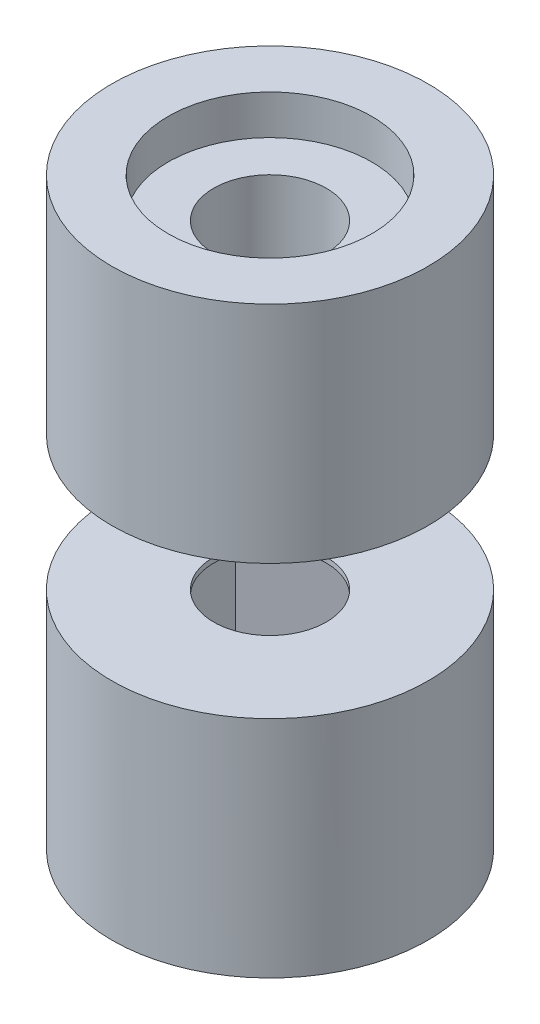
from build123d import *

# Parameters (mm, degrees)
SKETCH1_R               = 8
BOSS_EXTRUDE1_DEPTH     = 29.524
CUT_EXTRUDE1_DEPTH      = 32.617504266
CUT_EXTRUDE1_DEPTH_BACK = 32.617504266
SKETCH2_W               = 20.4
SKETCH2_H               = 6.8
SKETCH3_R               = 2.85
CUT_EXTRUDE2_DEPTH      = 29.524
SKETCH4_R               = 5.15
CUT_EXTRUDE3_DEPTH      = 2
CUT_EXTRUDE4_DEPTH      = 11.1


with BuildPart() as part:
    # Sketch1 → Boss-Extrude1 (new body)
    with BuildSketch(Plane(origin=(0, 0, 0), x_dir=(1, 0, 0), z_dir=(0, 1, 0))):
        Circle(SKETCH1_R)
    extrude(amount=BOSS_EXTRUDE1_DEPTH)

    # Sketch2 → Cut-Extrude1 (cut, two sides: drawn at the far end of the back side and taken through both)
    with BuildSketch(Plane.XY.offset(-CUT_EXTRUDE1_DEPTH_BACK)):
        with Locations((0, 14.762)):
            Rectangle(SKETCH2_W, SKETCH2_H)
    extrude(amount=CUT_EXTRUDE1_DEPTH + CUT_EXTRUDE1_DEPTH_BACK, mode=Mode.SUBTRACT)


with BuildPart() as cut_extrude1_piece_1:
    # of the separate pieces the step leaves, piece 1, a body of its own (cut_extrude1_pieces)
    add(part.part.solids().sort_by_distance((8, 0, 0))[0])


with BuildPart() as cut_extrude1_piece_2:
    # of the separate pieces the step leaves, piece 2, a body of its own (cut_extrude1_pieces)
    add(part.part.solids().sort_by_distance((8, 18.162, 0))[0])


with BuildPart() as cut_extrude2_tool:
    # Sketch3 → Cut-Extrude2 (new body)
    with BuildSketch(Plane(origin=(0, 0, 0), x_dir=(1, 0, 0), z_dir=(0, 1, 0))):
        Circle(SKETCH3_R)
    extrude(amount=CUT_EXTRUDE2_DEPTH)


with BuildPart() as cut_extrude1_piece_1_1:
    add(cut_extrude1_piece_1.part)

    # Cut-Extrude2: cut by cut_extrude2_tool
    add(cut_extrude2_tool.part, mode=Mode.SUBTRACT)

    # Sketch5 → Cut-Extrude4 (cut)
    with BuildSketch(Plane(origin=(0, 0, 0), x_dir=(1, 0, 0), z_dir=(0, 1, 0))):
        Polygon((4.1, -2.367136104), (0, -4.734272207), (-4.1, -2.367136104), (-4.1, 2.367136104), (0, 4.734272207), (4.1, 2.367136104), align=None)
    extrude(amount=CUT_EXTRUDE4_DEPTH, mode=Mode.SUBTRACT)


with BuildPart() as cut_extrude1_piece_2_1:
    add(cut_extrude1_piece_2.part)

    # Cut-Extrude2: cut by cut_extrude2_tool
    add(cut_extrude2_tool.part, mode=Mode.SUBTRACT)

    # Sketch4 → Cut-Extrude3 (cut)
    with BuildSketch(Plane(origin=(0, 29.524, 0), x_dir=(1, 0, 0), z_dir=(0, 1, 0))):
        Circle(SKETCH4_R)
    extrude(amount=-CUT_EXTRUDE3_DEPTH, mode=Mode.SUBTRACT)


solid = Compound([cut_extrude1_piece_1_1.part, cut_extrude1_piece_2_1.part])
